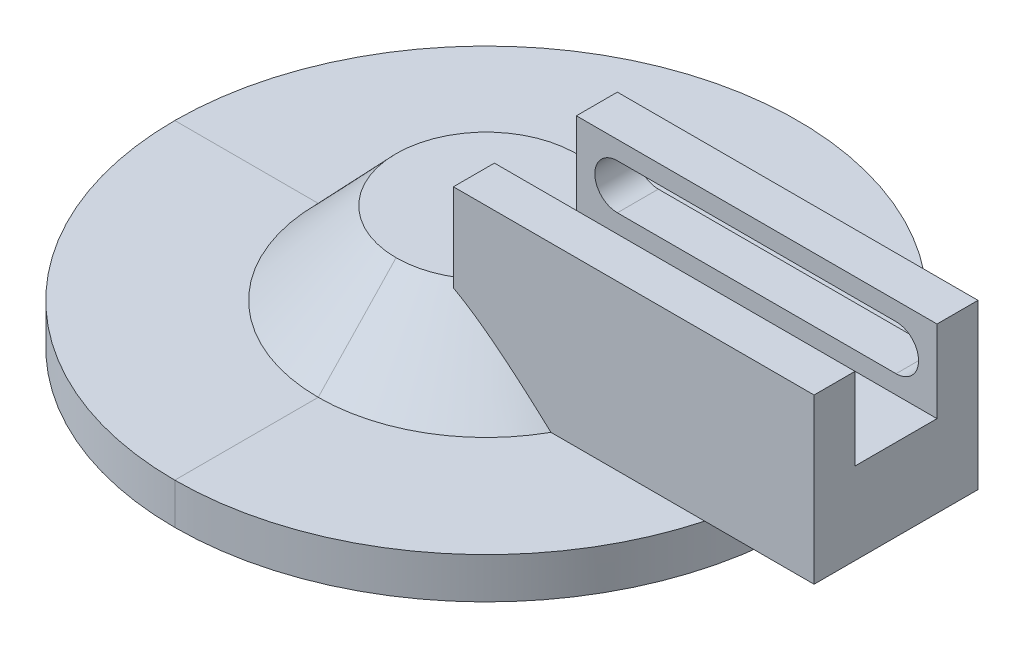
from build123d import *

# Parameters (mm, degrees)
SKETCH1_R               = 2.55
BOSS_EXTRUDE1_DEPTH     = 7.5
BOSS_EXTRUDE2_DEPTH     = 2.5
SKETCH3_W               = 44
SKETCH3_H               = 5
BOSS_EXTRUDE3_DEPTH     = 10
CUT_EXTRUDE1_DEPTH      = 53.306787322
CUT_EXTRUDE1_DEPTH_BACK = 5


with BuildPart() as part:
    # Sketch1 → Boss-Extrude1 (new body)
    with BuildSketch(Plane(origin=(0, 0, 0), x_dir=(1, 0, 0), z_dir=(0, 1, 0))):
        with BuildLine():
            Line((0, 14), (-6, 14))
            ThreePointArc((-6, 14), (-10, 10), (-6, 6))
            Line((-6, 6), (0, 6))
            Line((0, 6), (0, 0))
            Line((0, 0), (44, 0))
            Line((44, 0), (44, 20))
            Line((44, 20), (0, 20))
            Line((0, 20), (0, 14))
        make_face()
        with Locations((-6, 10)):
            Circle(SKETCH1_R, mode=Mode.SUBTRACT)
    extrude(amount=BOSS_EXTRUDE1_DEPTH)

    # Sketch2 → Boss-Extrude2 (add)
    with BuildSketch(Plane(origin=(0, 7.5, 0), x_dir=(1, 0, 0), z_dir=(0, 1, 0))):
        with BuildLine():
            Line((0, 0), (44, 0))
            Line((44, 0), (44, 20))
            Line((44, 20), (0, 20))
            Line((0, 20), (0, 14))
            Line((0, 14), (-6, 14))
            ThreePointArc((-6, 14), (-10, 10), (-6, 6))
            Line((-6, 6), (0, 6))
            Line((0, 6), (0, 0))
        make_face()
    extrude(amount=BOSS_EXTRUDE2_DEPTH)

    # Sketch3 → Boss-Extrude3 (add)
    with BuildSketch(Plane(origin=(0, 10, 0), x_dir=(1, 0, 0), z_dir=(0, 1, 0))):
        with Locations((22, 2.5)):
            Rectangle(SKETCH3_W, SKETCH3_H)
        with Locations((22, 17.5)):
            Rectangle(SKETCH3_W, SKETCH3_H)
    extrude(amount=BOSS_EXTRUDE3_DEPTH)

    # Sketch4 → Cut-Extrude1 (cut, two sides: drawn at the far end of the back side and taken through both)
    with BuildSketch(Plane(origin=(0, 0, -20), x_dir=(-1, 0, 0), z_dir=(0, 0, -1)).offset(-CUT_EXTRUDE1_DEPTH_BACK)):
        with BuildLine():
            Line((-5, 17.75), (-39, 17.75))
            ThreePointArc((-39, 17.75), (-41.75, 15), (-39, 12.25))
            Line((-39, 12.25), (-5, 12.25))
            ThreePointArc((-5, 12.25), (-2.25, 15), (-5, 17.75))
        make_face()
    extrude(amount=CUT_EXTRUDE1_DEPTH + CUT_EXTRUDE1_DEPTH_BACK, mode=Mode.SUBTRACT)

    # Sweep1: sweep along a curve in space
    with BuildLine() as sweep1_path:
        ThreePointArc((-6, 0, -7.45), (-4.196877708, 0, -8.196877708), (-3.45, 0, -10))
        ThreePointArc((-3.45, 0, -10), (-4.196877708, 0, -11.803122292), (-6, 0, -12.55))
        ThreePointArc((-6, 0, -12.55), (-7.803122292, 0, -11.803122292), (-8.55, 0, -10))
        ThreePointArc((-8.55, 0, -10), (-7.803122292, 0, -8.196877708), (-6, 0, -7.45))
    # 3DSketch1 → Sweep1 (sweep)
    with BuildSketch(Plane(origin=(-8.55, 0, -10), x_dir=(-0.9901993201277149, -0.13966139917175113, 0), z_dir=(0, 0, -1))):
        Polygon((0, 0), (-1.396613992, 9.901993201), (6.970570263, 11.082132024), (17.774077796, 2.506922115), (35.102565899, 4.950996601), (35.800872894, 0), (18.472384792, -2.444074486), (8.367184255, 1.180138823), align=None)
    sweep(path=sweep1_path.line)


solid = part.part
